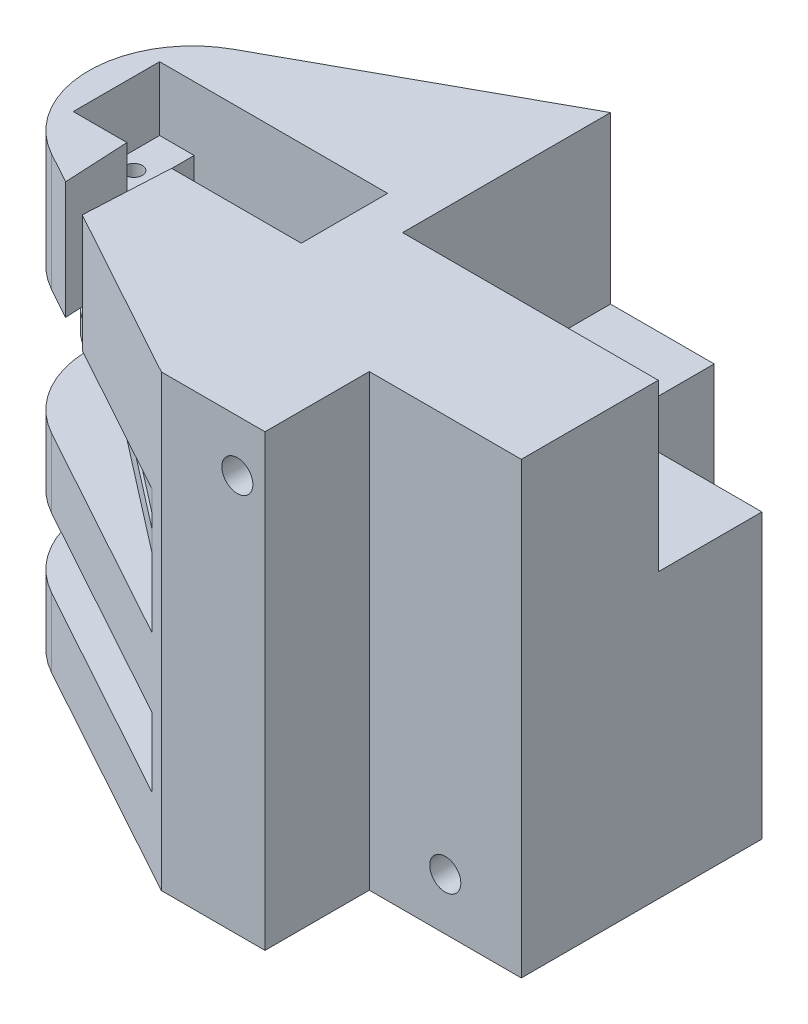
from build123d import *

# Parameters (mm, degrees)
SKETCH1_W               = 80
SKETCH1_H               = 65
BOSS_EXTRUDE1_DEPTH     = 65
SKETCH3_W               = 22
SKETCH3_H               = 15.09
CUT_EXTRUDE1_DEPTH      = 65.72
CUT_EXTRUDE2_DEPTH      = 20
CUT_EXTRUDE2_DEPTH_BACK = 55.72
SKETCH4_R               = 2.24505
SKETCH4_R_2             = 2.245
SKETCH5_W               = 65
SKETCH5_H               = 10
SKETCH5_H_2             = 2
CUT_EXTRUDE3_DEPTH      = 40
CUT_EXTRUDE4_DEPTH      = 65
SKETCH10_R              = 1
CUT_EXTRUDE6_DEPTH      = 42
CUT_EXTRUDE7_DEPTH      = 20
SKETCH14_W              = 23
SKETCH14_H              = 12.5
CUT_EXTRUDE9_DEPTH      = 13.75
SKETCH16_W              = 5
SKETCH16_H              = 12.5
CUT_EXTRUDE10_DEPTH     = 9.25
SKETCH16_4_R            = 1.25
CUT_EXTRUDE11_DEPTH     = 12.5
CUT_EXTRUDE12_DEPTH     = 21.5
CUT_EXTRUDE13_DEPTH     = 8
SKETCH20_R              = 2
BOSS_EXTRUDE2_DEPTH     = 0.5
SKETCH21_R              = 2
BOSS_EXTRUDE3_DEPTH     = 0.5
SKETCH22_R              = 1
CUT_EXTRUDE14_DEPTH     = 30.5
SKETCH23_W              = 37
SKETCH23_H              = 30.09
CUT_EXTRUDE15_DEPTH     = 24


with BuildPart() as part:
    # Sketch1 → Boss-Extrude1 (new body)
    with BuildSketch(Plane.XY):
        with Locations((40, 32.5)):
            Rectangle(SKETCH1_W, SKETCH1_H)
    extrude(amount=BOSS_EXTRUDE1_DEPTH)

    # Sketch3 → Cut-Extrude1 (cut)
    with BuildSketch(Plane.XZ):
        with Locations((69, 57.455)):
            Rectangle(SKETCH3_W, SKETCH3_H)
        with Locations((69, 7.545)):
            Rectangle(SKETCH3_W, SKETCH3_H)
    extrude(amount=-CUT_EXTRUDE1_DEPTH, mode=Mode.SUBTRACT)

    # Sketch4 → Cut-Extrude2 (cut, two sides: drawn at the far end of the back side and taken through both)
    with BuildSketch(Plane.XY.offset(49.91).offset(-CUT_EXTRUDE2_DEPTH_BACK)):
        with Locations((69, 7.5)):
            Circle(SKETCH4_R)
        with Locations((54, 57.5)):
            Circle(SKETCH4_R_2)
    extrude(amount=CUT_EXTRUDE2_DEPTH + CUT_EXTRUDE2_DEPTH_BACK, mode=Mode.SUBTRACT)

    # Sketch5 → Cut-Extrude3 (cut)
    with BuildSketch(Plane.ZY):
        with Locations((32.5, 15)):
            Rectangle(SKETCH5_W, SKETCH5_H)
        with Locations((32.5, 35)):
            Rectangle(SKETCH5_W, SKETCH5_H)
        with Locations((32.5, 44)):
            Rectangle(SKETCH5_W, SKETCH5_H_2)
    extrude(amount=-CUT_EXTRUDE3_DEPTH, mode=Mode.SUBTRACT)

    # Sketch6 → Cut-Extrude4 (cut)
    with BuildSketch(Plane.XZ):
        with BuildLine():
            Line((0, 0), (43, 0))
            Line((43, 0), (7.776682895, 19.353757571))
            ThreePointArc((7.776682895, 19.353757571), (2.089737482, 24.862911437), (0, 32.5))
            Line((0, 32.5), (0, 0))
        make_face()
        with BuildLine():
            Line((0, 65), (0, 32.5))
            ThreePointArc((0, 32.5), (2.089737482, 40.137088563), (7.776682895, 45.646242429))
            Line((7.776682895, 45.646242429), (43, 65))
            Line((43, 65), (0, 65))
        make_face()
    extrude(amount=-CUT_EXTRUDE4_DEPTH, mode=Mode.SUBTRACT)

    # Sketch10 → Cut-Extrude6 (cut)
    with BuildSketch(Plane.XZ):
        with Locations((15, 32.5)):
            Circle(SKETCH10_R)
    extrude(amount=-CUT_EXTRUDE6_DEPTH, mode=Mode.SUBTRACT)

    # Sketch12 → Cut-Extrude7 (cut)
    with BuildSketch(Plane(origin=(0, 65, 0), x_dir=(1, 0, 0), z_dir=(0, 1, 0))):
        with BuildLine():
            ThreePointArc((20.252618395, -29.6), (9, -32.5), (20.252618395, -35.4))
            Line((20.252618395, -35.4), (21.452618395, -35.4))
            ThreePointArc((21.452618395, -35.4), (24.352618395, -32.5), (21.452618395, -29.6))
            Line((21.452618395, -29.6), (20.252618395, -29.6))
        make_face()
    extrude(amount=-CUT_EXTRUDE7_DEPTH, mode=Mode.SUBTRACT)

    # Sketch14 → Cut-Extrude9 (cut)
    with BuildSketch(Plane(origin=(0, 65, 0), x_dir=(1, 0, 0), z_dir=(0, 1, 0))):
        with Locations((20.5, -32.5)):
            Rectangle(SKETCH14_W, SKETCH14_H)
    extrude(amount=-CUT_EXTRUDE9_DEPTH, mode=Mode.SUBTRACT)

    # Sketch16 → Cut-Extrude10 (cut)
    with BuildSketch(Plane(origin=(0, 65, 0), x_dir=(1, 0, 0), z_dir=(0, 1, 0))):
        with Locations((6.5, -32.5)):
            Rectangle(SKETCH16_W, SKETCH16_H)
        with Locations((34.5, -32.5)):
            Rectangle(SKETCH16_W, SKETCH16_H)
    extrude(amount=-CUT_EXTRUDE10_DEPTH, mode=Mode.SUBTRACT)

    # Sketch16<4> → Cut-Extrude11 (cut)
    with BuildSketch(Plane(origin=(0, 65, 0), x_dir=(1, 0, 0), z_dir=(0, 1, 0))):
        with Locations((6.5, -32.5)):
            Circle(SKETCH16_4_R)
        with Locations((34.5, -32.5)):
            Circle(SKETCH16_4_R)
    extrude(amount=-CUT_EXTRUDE11_DEPTH, mode=Mode.SUBTRACT)

    # Sketch18 → Cut-Extrude12 (cut)
    with BuildSketch(Plane(origin=(0, 65, 0), x_dir=(1, 0, 0), z_dir=(0, 1, 0))):
        with BuildLine():
            Line((11.45, -32.5), (12.25004092, -48.104167856))
            Line((12.25004092, -48.104167856), (17.599264584, -51.043345268))
            Line((17.599264584, -51.043345268), (18.55, -32.5))
            ThreePointArc((18.55, -32.5), (15, -28.95), (11.45, -32.5))
        make_face()
    extrude(amount=-CUT_EXTRUDE12_DEPTH, mode=Mode.SUBTRACT)

    # Sketch19 → Cut-Extrude13 (cut)
    with BuildSketch(Plane.XZ.offset(-40)):
        with BuildLine():
            Line((15, 44), (40, 63.351623939))
            Line((40, 63.351623939), (7.776682895, 45.646242429))
            ThreePointArc((7.776682895, 45.646242429), (0, 32.5), (7.776682895, 19.353757571))
            Line((7.776682895, 19.353757571), (40, 1.648376061))
            Line((40, 1.648376061), (15, 21))
            ThreePointArc((15, 21), (3.5, 32.5), (15, 44))
        make_face()
    extrude(amount=-CUT_EXTRUDE13_DEPTH, mode=Mode.SUBTRACT)

    # Sketch20 → Boss-Extrude2 (add)
    with BuildSketch(Plane(origin=(0, 30, 0), x_dir=(1, 0, 0), z_dir=(0, 1, 0))):
        with Locations((15, -32.5)):
            Circle(SKETCH20_R)
    extrude(amount=BOSS_EXTRUDE2_DEPTH)

    # Sketch21 → Boss-Extrude3 (add)
    with BuildSketch(Plane(origin=(0, 10, 0), x_dir=(1, 0, 0), z_dir=(0, 1, 0))):
        with Locations((15, -32.5)):
            Circle(SKETCH21_R)
    extrude(amount=BOSS_EXTRUDE3_DEPTH)

    # Sketch22 → Cut-Extrude14 (cut)
    with BuildSketch(Plane.XZ):
        with Locations((15, 32.5)):
            Circle(SKETCH22_R)
    extrude(amount=-CUT_EXTRUDE14_DEPTH, mode=Mode.SUBTRACT)

    # Sketch23 → Cut-Extrude15 (cut)
    with BuildSketch(Plane(origin=(0, 65, 0), x_dir=(1, 0, 0), z_dir=(0, 1, 0))):
        with Locations((61.5, -15.045)):
            Rectangle(SKETCH23_W, SKETCH23_H)
    extrude(amount=-CUT_EXTRUDE15_DEPTH, mode=Mode.SUBTRACT)


solid = part.part
